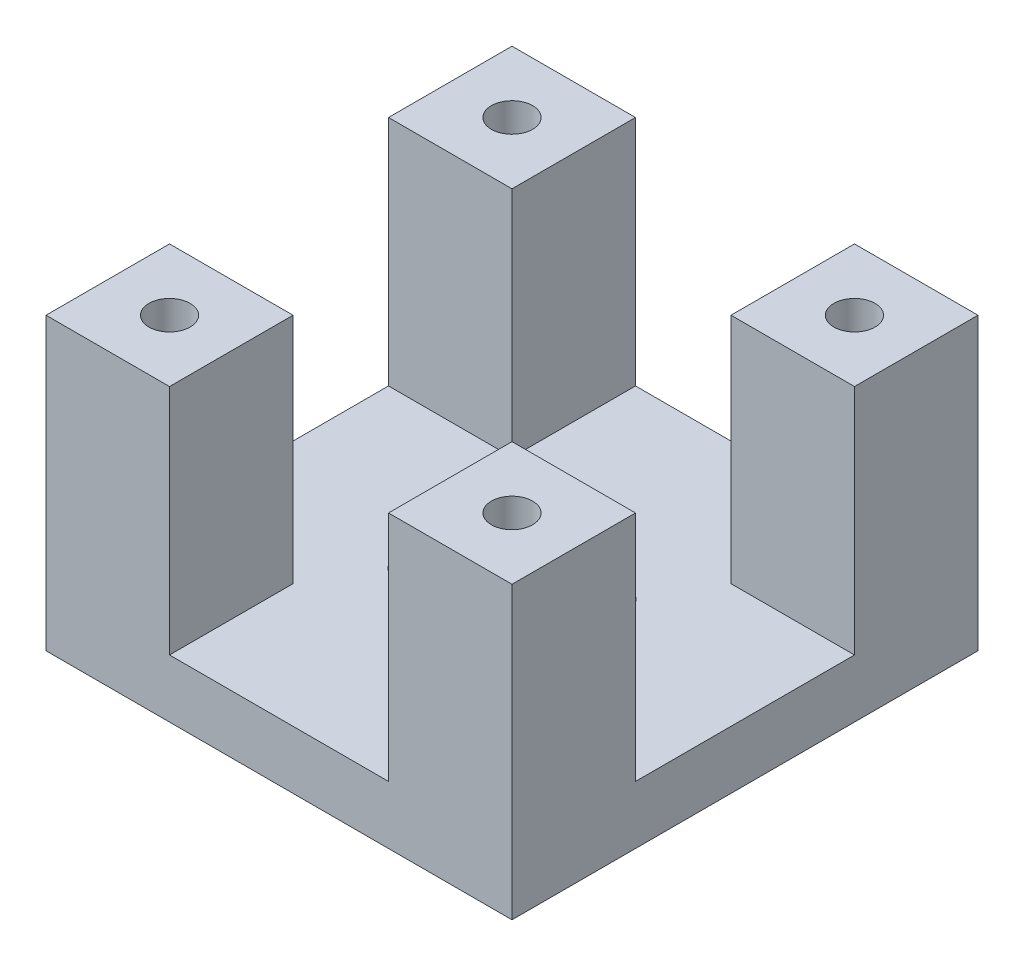
from build123d import *

# Parameters (mm, degrees)
SKETCH1_W                               = 96.210678118
SKETCH1_H                               = 96.210678118
SKETCH1_R                               = 11
SKETCH1_R_2                             = 2
SKETCH1_R_3                             = 4.25
MAIN_BODY_DEPTH                         = 60
MAIN_MILL_CUT_DEPTH                     = 48
SKETCH2_R                               = 3.625
MOTOR_MOUNT_BOLT_HEAD_COUNTERSINK_DEPTH = 54


with BuildPart() as part:
    # Sketch1 → main body (new body)
    with BuildSketch(Plane(origin=(0, 0, 0), x_dir=(1, 0, 0), z_dir=(0, 1, 0))):
        Rectangle(SKETCH1_W, SKETCH1_H)
        Circle(SKETCH1_R, mode=Mode.SUBTRACT)
        with Locations((0, 15)):
            Circle(SKETCH1_R_2, mode=Mode.SUBTRACT)
        with Locations((35.355339059, 35.355339059)):
            Circle(SKETCH1_R_3, mode=Mode.SUBTRACT)
        with Locations((12.990381057, 7.5)):
            Circle(SKETCH1_R_2, mode=Mode.SUBTRACT)
        with Locations((12.990381057, -7.5)):
            Circle(SKETCH1_R_2, mode=Mode.SUBTRACT)
        with Locations((0, -15)):
            Circle(SKETCH1_R_2, mode=Mode.SUBTRACT)
        with Locations((-12.990381057, -7.5)):
            Circle(SKETCH1_R_2, mode=Mode.SUBTRACT)
        with Locations((-12.990381057, 7.5)):
            Circle(SKETCH1_R_2, mode=Mode.SUBTRACT)
        with Locations((35.355339059, -35.355339059)):
            Circle(SKETCH1_R_3, mode=Mode.SUBTRACT)
        with Locations((-35.355339059, -35.355339059)):
            Circle(SKETCH1_R_3, mode=Mode.SUBTRACT)
        with Locations((-35.355339059, 35.355339059)):
            Circle(SKETCH1_R_3, mode=Mode.SUBTRACT)
    extrude(amount=MAIN_BODY_DEPTH)

    # Sketch4 → main mill cut (cut)
    with BuildSketch(Plane(origin=(0, 60, 0), x_dir=(1, 0, 0), z_dir=(0, 1, 0))):
        Polygon((-22.605339059, 48.105339059), (22.605339059, 48.105339059), (22.605339059, 22.605339059), (48.105339059, 22.605339059), (48.105339059, -22.605339059), (22.605339059, -22.605339059), (22.605339059, -48.105339059), (-22.605339059, -48.105339059), (-22.605339059, -22.605339059), (-48.105339059, -22.605339059), (-48.105339059, 22.605339059), (-22.605339059, 22.605339059), align=None)
    extrude(amount=-MAIN_MILL_CUT_DEPTH, mode=Mode.SUBTRACT)

    # Sketch2 → motor mount bolt head countersink (cut)
    with BuildSketch(Plane(origin=(0, 60, 0), x_dir=(1, 0, 0), z_dir=(0, 1, 0))):
        with Locations((12.990381057, 7.5)):
            Circle(SKETCH2_R)
        with Locations((0, 15)):
            Circle(SKETCH2_R)
        with Locations((12.990381057, -7.5)):
            Circle(SKETCH2_R)
        with Locations((0, -15)):
            Circle(SKETCH2_R)
        with Locations((-12.990381057, -7.5)):
            Circle(SKETCH2_R)
        with Locations((-12.990381057, 7.5)):
            Circle(SKETCH2_R)
    extrude(amount=-MOTOR_MOUNT_BOLT_HEAD_COUNTERSINK_DEPTH, mode=Mode.SUBTRACT)


solid = part.part
